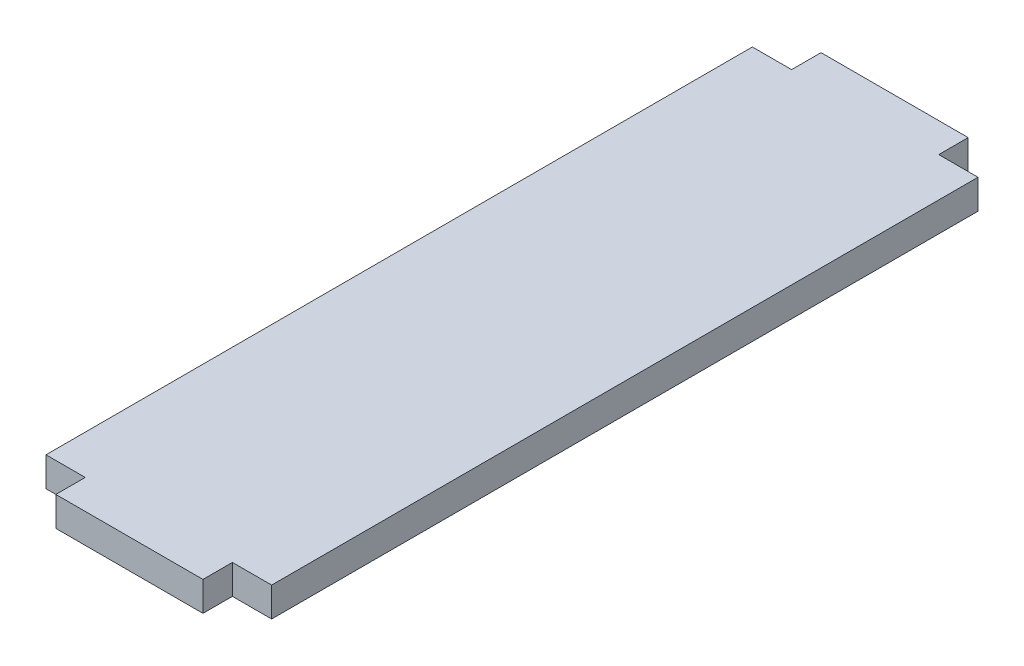
from build123d import *

# Parameters (mm, degrees)
BOSS_EXTRUDE1_DEPTH = 1.5


with BuildPart() as part:
    # Sketch1 → Boss-Extrude1 (new body)
    with BuildSketch(Plane(origin=(0, 0, 0), x_dir=(1, 0, 0), z_dir=(0, 1, 0))):
        Polygon((3.75, 18), (5.75, 18), (5.75, -18), (3.75, -18), (3.75, -19.5), (-3.75, -19.5), (-3.75, -18), (-5.75, -18), (-5.75, 18), (-3.75, 18), (-3.75, 19.5), (3.75, 19.5), align=None)
    extrude(amount=BOSS_EXTRUDE1_DEPTH)


solid = part.part
